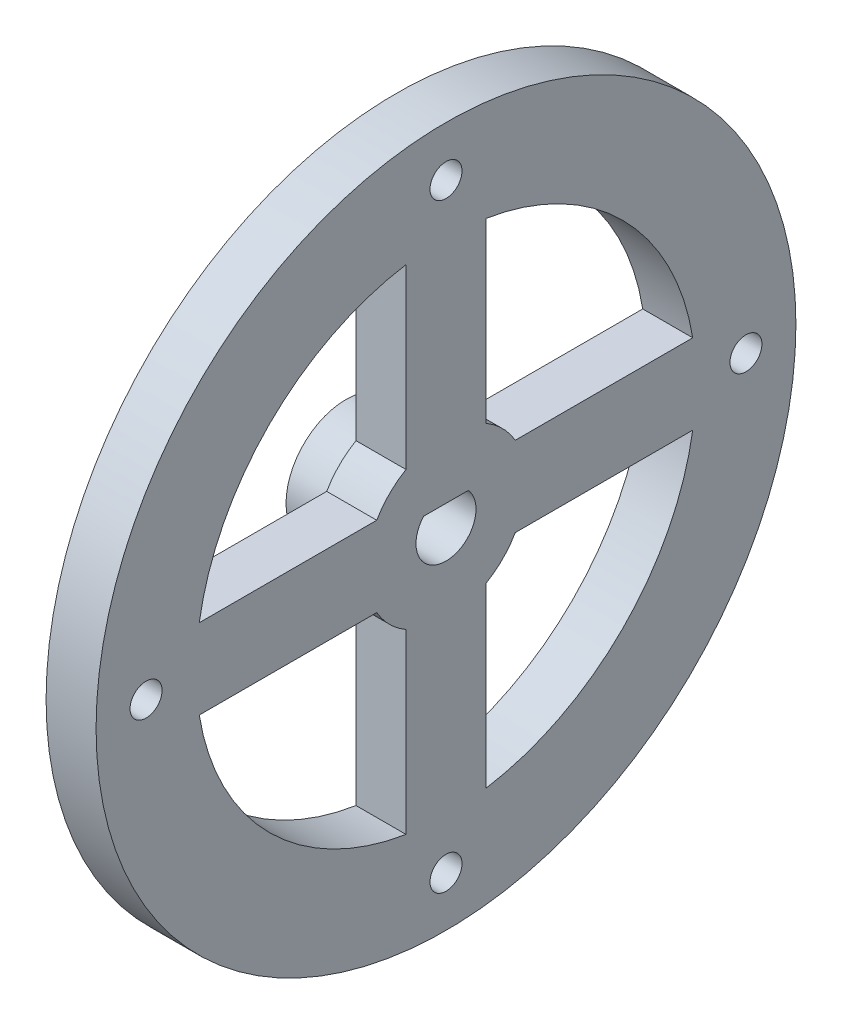
from build123d import *
from build123d.topology import SkipClean

# Parameters (mm, degrees)
SKETCH1_R           = 35
BOSS_EXTRUDE1_DEPTH = 5
SKETCH2_R           = 1.6
CUT_EXTRUDE1_DEPTH  = 50.749371855
BOSS_EXTRUDE2_START = 5
SKETCH3_R           = 6
BOSS_EXTRUDE2_DEPTH = 5
SKETCH6_R           = 3
CUT_EXTRUDE2_DEPTH  = 2


with BuildPart() as part:
    # Sketch1 → Boss-Extrude1 (new body)
    with BuildSketch(Plane(origin=(0, 0, 0), x_dir=(0, 0, -1), z_dir=(1, 0, 0))):
        Circle(SKETCH1_R)
        with BuildLine():
            Line((4, 6.92820323), (4, 24.677925359))
            ThreePointArc((4, 24.677925359), (17.67766953, 17.67766953), (24.677925359, 4))
            Line((24.677925359, 4), (6.92820323, 4))
            ThreePointArc((6.92820323, 4), (5.656854249, 5.656854249), (4, 6.92820323))
        make_face(mode=Mode.SUBTRACT)
        with BuildLine():
            Line((-4, 24.677925359), (-4, 6.92820323))
            ThreePointArc((-4, 6.92820323), (-5.656854249, 5.656854249), (-6.92820323, 4))
            Line((-6.92820323, 4), (-24.677925359, 4))
            ThreePointArc((-24.677925359, 4), (-17.67766953, 17.67766953), (-4, 24.677925359))
        make_face(mode=Mode.SUBTRACT)
        with BuildLine():
            Line((-24.677925359, -4), (-6.92820323, -4))
            ThreePointArc((-6.92820323, -4), (-5.656854249, -5.656854249), (-4, -6.92820323))
            Line((-4, -6.92820323), (-4, -24.677925359))
            ThreePointArc((-4, -24.677925359), (-17.67766953, -17.67766953), (-24.677925359, -4))
        make_face(mode=Mode.SUBTRACT)
        with BuildLine():
            Line((4, -24.677925359), (4, -6.92820323))
            ThreePointArc((4, -6.92820323), (5.656854249, -5.656854249), (6.92820323, -4))
            Line((6.92820323, -4), (24.677925359, -4))
            ThreePointArc((24.677925359, -4), (17.67766953, -17.67766953), (4, -24.677925359))
        make_face(mode=Mode.SUBTRACT)
        with BuildLine():
            Line((-2.236067977, 2), (2.236067977, 2))
            ThreePointArc((2.236067977, 2), (0, -3), (-2.236067977, 2))
        make_face(mode=Mode.SUBTRACT)
    extrude(amount=BOSS_EXTRUDE1_DEPTH)

    # Sketch2 → Cut-Extrude1 (cut, through all)
    with BuildSketch(Plane.ZY):
        with Locations((0, 30)):
            Circle(SKETCH2_R)
        with Locations((30, 0)):
            Circle(SKETCH2_R)
        with Locations((0, -30)):
            Circle(SKETCH2_R)
        with Locations((-30, 0)):
            Circle(SKETCH2_R)
    extrude(amount=-CUT_EXTRUDE1_DEPTH, mode=Mode.SUBTRACT)

    # Sketch3 → Boss-Extrude2 (add)
    with SkipClean():  # the faces are left unmerged after this step: merging them gives an invalid solid
        with BuildSketch(Plane.ZY.offset(BOSS_EXTRUDE2_START)):
            Circle(SKETCH3_R)
            with BuildLine():
                Line((-2.236067977, 2), (2.236067977, 2))
                ThreePointArc((2.236067977, 2), (0, -3), (-2.236067977, 2))
            make_face(mode=Mode.SUBTRACT)
        extrude(amount=-BOSS_EXTRUDE2_DEPTH)

    # Sketch6 → Cut-Extrude2 (cut)
    with SkipClean():  # the faces are left unmerged after this step: merging them gives an invalid solid
        with BuildSketch(Plane.ZY):
            with Locations((0, 30)):
                Circle(SKETCH6_R)
            with Locations((30, 0)):
                Circle(SKETCH6_R)
            with Locations((0, -30)):
                Circle(SKETCH6_R)
            with Locations((-30, 0)):
                Circle(SKETCH6_R)
        extrude(amount=-CUT_EXTRUDE2_DEPTH, mode=Mode.SUBTRACT)


solid = part.part
